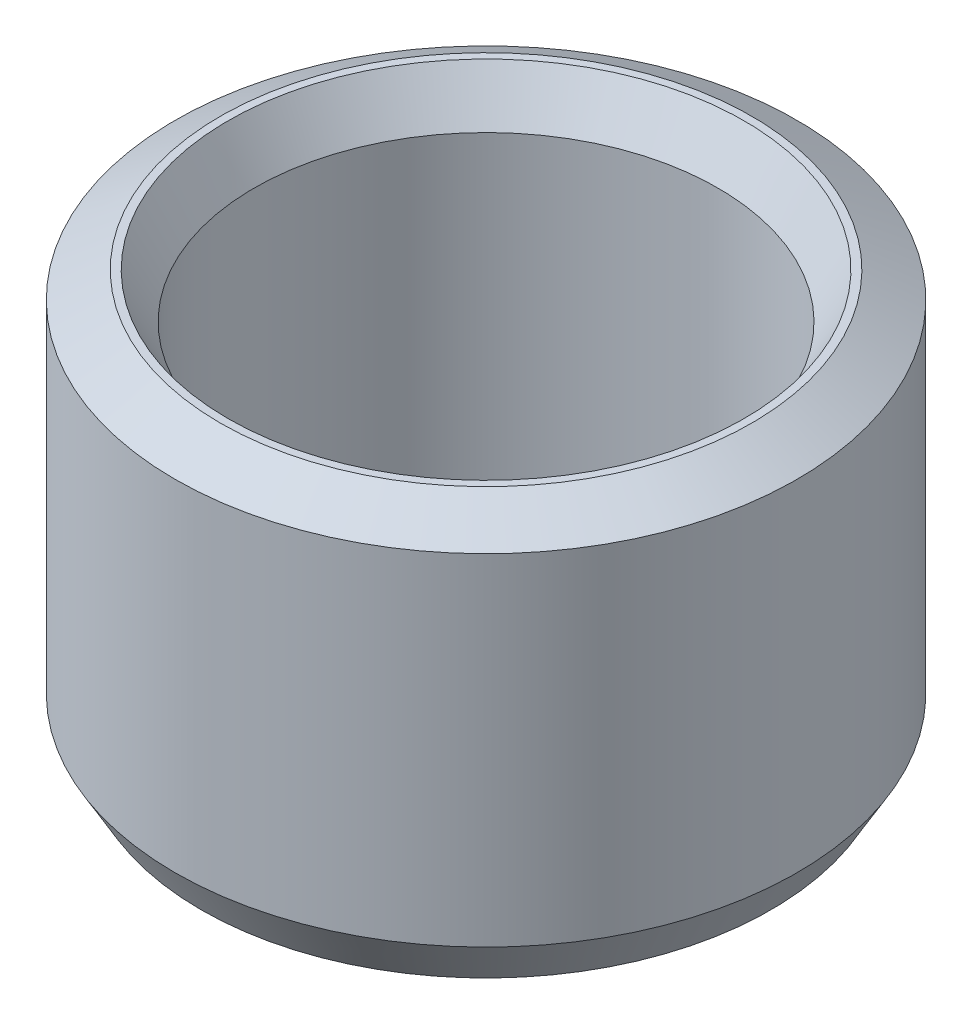
from build123d import *
from OCP.BRepFilletAPI import BRepFilletAPI_MakeChamfer

# Parameters (mm, degrees)
SKETCH1_R           = 30
BOSS_EXTRUDE1_DEPTH = 39.74912339
SKETCH2_R           = 22.372617882
CUT_EXTRUDE1_DEPTH  = 59.137705582
CHAMFER1_SIZE       = 2.518361908
CHAMFER1_SIZE2      = 4.361930776


with BuildPart() as part:
    # Sketch1 → Boss-Extrude1 (new body)
    with BuildSketch(Plane(origin=(0, 0, 0), x_dir=(1, 0, 0), z_dir=(0, 1, 0))):
        Circle(SKETCH1_R)
    extrude(amount=BOSS_EXTRUDE1_DEPTH)

    # Sketch2 → Cut-Extrude1 (cut, through all)
    with BuildSketch(Plane(origin=(0, 0, 0), x_dir=(1, 0, 0), z_dir=(0, 1, 0))):
        Circle(SKETCH2_R)
    extrude(amount=CUT_EXTRUDE1_DEPTH, mode=Mode.SUBTRACT)

    # Chamfer1: one chamfer whose edges measure the first distance from different faces: ONE call of the kernel's chamfer builder (chamfer() names one face for all edges)
    chamfer1_edges_1 = [part.edges().sort_by_distance(p)[0] for p in [
        (-22.372617882, 39.74912339, 0),
    ]]
    chamfer1_side_1 = [part.faces().sort_by_distance(p)[0] for p in [
        (-29.151471863, 39.74912339, 0),
    ]]
    chamfer1_edges_2 = [part.edges().sort_by_distance(p)[0] for p in [
        (-22.372617882, 0, 0),
    ]]
    chamfer1_side_2 = [part.faces().sort_by_distance(p)[0] for p in [
        (-22.372617882, 19.874561695, 0),
    ]]
    chamfer1_edges_3 = [part.edges().sort_by_distance(p)[0] for p in [
        (-30, 0, 0),
    ]]
    chamfer1_side_3 = [part.faces().sort_by_distance(p)[0] for p in [
        (-29.151471863, 0, 0),
    ]]
    chamfer1_edges_4 = [part.edges().sort_by_distance(p)[0] for p in [
        (-30, 39.74912339, 0),
    ]]
    chamfer1_side_4 = [part.faces().sort_by_distance(p)[0] for p in [
        (-30, 19.874561695, 0),
    ]]
    chamfer1 = BRepFilletAPI_MakeChamfer(part.part.solid().wrapped)
    for e in chamfer1_edges_1:
        chamfer1.Add(CHAMFER1_SIZE, CHAMFER1_SIZE2, e.wrapped, chamfer1_side_1[0].wrapped)  # the first distance lies on this face
    for e in chamfer1_edges_2:
        chamfer1.Add(CHAMFER1_SIZE, CHAMFER1_SIZE2, e.wrapped, chamfer1_side_2[0].wrapped)  # the first distance lies on this face
    for e in chamfer1_edges_3:
        chamfer1.Add(CHAMFER1_SIZE, CHAMFER1_SIZE2, e.wrapped, chamfer1_side_3[0].wrapped)  # the first distance lies on this face
    for e in chamfer1_edges_4:
        chamfer1.Add(CHAMFER1_SIZE, CHAMFER1_SIZE2, e.wrapped, chamfer1_side_4[0].wrapped)  # the first distance lies on this face
    add(Compound.cast(chamfer1.Shape()), mode=Mode.REPLACE)


solid = part.part
